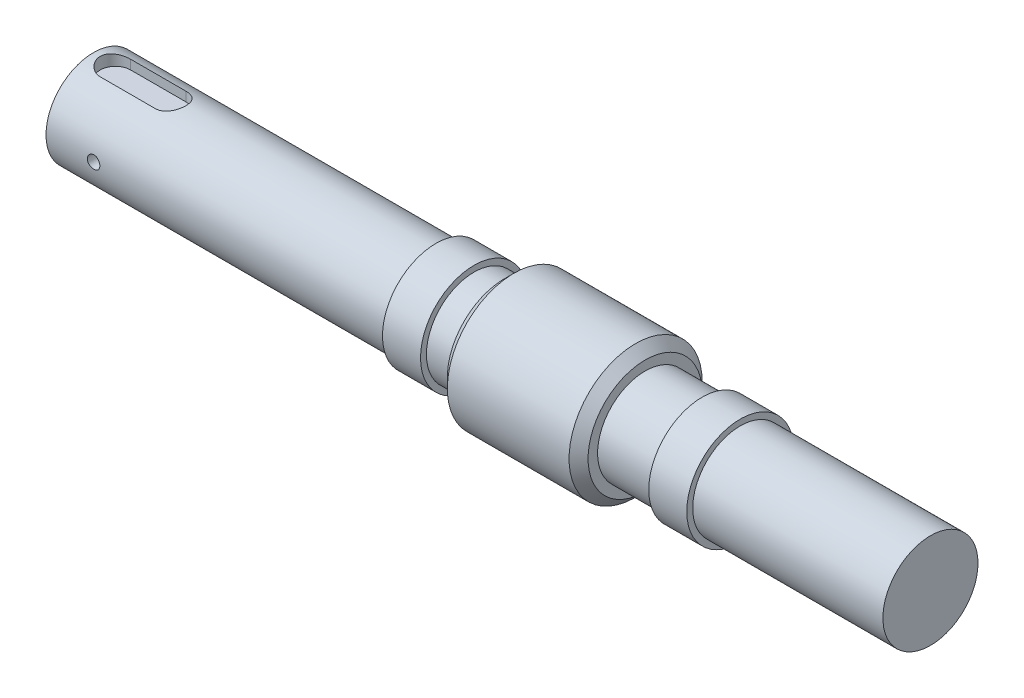
from build123d import *

# Parameters (mm, degrees)
CROQUIS1_R                                 = 35
SALIENTE_EXTRUIR1_DEPTH                    = 37
CHAFL_N1_SIZE                              = 5
CROQUIS2_R                                 = 25
SALIENTE_EXTRUIR2_DEPTH                    = 16
CROQUIS3_R                                 = 28.1
SALIENTE_EXTRUIR3_DEPTH                    = 120
SALIENTE_EXTRUIR4_START                    = 30
CROQUIS4_R                                 = 25
SALIENTE_EXTRUIR4_DEPTH                    = 30
SALIENTE_EXTRUIR5_START                    = 120
CROQUIS5_R                                 = 28.1
SALIENTE_EXTRUIR5_DEPTH                    = 120
CORTAR_EXTRUIR1_START                      = -100
CROQUIS6_R                                 = 28.1
CROQUIS6_R_2                               = 25
CORTAR_EXTRUIR1_DEPTH                      = 100
CROQUIS8_R                                 = 28.1
CROQUIS8_R_2                               = 25
CORTAR_EXTRUIR2_DEPTH                      = 100
CROQUIS9_R                                 = 25
SALIENTE_EXTRUIR6_DEPTH                    = 80
CORTAR_EXTRUIR3_START                      = 18.8
CORTAR_EXTRUIR3_DEPTH                      = 6.2
TALADRO_DE_MARGEN_PARA_M61_D               = 6.6
TALADRO_DE_MARGEN_PARA_M61_DEPTH           = 17
TALADRO_DE_MARGEN_PARA_M61_TIP             = 1.982840043
TALADRO_DE_MARGEN_PARA_M61_ON_FACE_2_D     = 6.6
TALADRO_DE_MARGEN_PARA_M61_ON_FACE_2_DEPTH = 17
TALADRO_DE_MARGEN_PARA_M61_ON_FACE_2_TIP   = 1.982840043


with BuildPart() as part:
    # Croquis1 → Saliente-Extruir1 (new, symmetric)
    with BuildSketch(Plane(origin=(0, 0, 0), x_dir=(0, 0, -1), z_dir=(1, 0, 0))):
        Circle(CROQUIS1_R)
    extrude(amount=SALIENTE_EXTRUIR1_DEPTH, both=True)

    # Chaflán1
    chafl_n1_edges = [part.edges().sort_by_distance(p)[0] for p in [
        (37, 0, 35),
        (-37, 0, 35),
    ]]
    chamfer(chafl_n1_edges, length=CHAFL_N1_SIZE)

    # Croquis2 → Saliente-Extruir2 (add)
    with BuildSketch(Plane.ZY.offset(37)):
        Circle(CROQUIS2_R)
    extrude(amount=SALIENTE_EXTRUIR2_DEPTH)

    # Croquis3 → Saliente-Extruir3 (add)
    with BuildSketch(Plane.ZY.offset(53)):
        Circle(CROQUIS3_R)
    extrude(amount=SALIENTE_EXTRUIR3_DEPTH)

    # Croquis4 → Saliente-Extruir4 (add)
    with BuildSketch(Plane(origin=(37, 0, 0), x_dir=(0, 0, -1), z_dir=(1, 0, 0)).offset(SALIENTE_EXTRUIR4_START)):
        Circle(CROQUIS4_R)
    extrude(amount=-SALIENTE_EXTRUIR4_DEPTH)

    # Croquis5 → Saliente-Extruir5 (add)
    with BuildSketch(Plane(origin=(67, 0, 0), x_dir=(0, 0, -1), z_dir=(1, 0, 0)).offset(SALIENTE_EXTRUIR5_START)):
        Circle(CROQUIS5_R)
    extrude(amount=-SALIENTE_EXTRUIR5_DEPTH)

    # Croquis6 → Cortar-Extruir1 (cut)
    with BuildSketch(Plane.ZY.offset(173).offset(CORTAR_EXTRUIR1_START)):
        Circle(CROQUIS6_R)
        Circle(CROQUIS6_R_2, mode=Mode.SUBTRACT)
    extrude(amount=CORTAR_EXTRUIR1_DEPTH, mode=Mode.SUBTRACT)

    # Croquis8 → Cortar-Extruir2 (cut)
    with BuildSketch(Plane(origin=(187, 0, 0), x_dir=(0, 0, -1), z_dir=(1, 0, 0))):
        Circle(CROQUIS8_R)
        Circle(CROQUIS8_R_2, mode=Mode.SUBTRACT)
    extrude(amount=-CORTAR_EXTRUIR2_DEPTH, mode=Mode.SUBTRACT)

    # Croquis9 → Saliente-Extruir6 (add)
    with BuildSketch(Plane.ZY.offset(173)):
        Circle(CROQUIS9_R)
    extrude(amount=SALIENTE_EXTRUIR6_DEPTH)

    # Croquis10 → Cortar-Extruir3 (cut)
    with BuildSketch(Plane(origin=(0, 0, 0), x_dir=(1, 0, 0), z_dir=(0, 1, 0)).offset(CORTAR_EXTRUIR3_START)):
        with BuildLine():
            Line((-241.5, 8), (-212.5, 8))
            ThreePointArc((-212.5, 8), (-204.5, 0), (-212.5, -8))
            Line((-212.5, -8), (-241.5, -8))
            ThreePointArc((-241.5, -8), (-249.5, 0), (-241.5, 8))
        make_face()
    extrude(amount=CORTAR_EXTRUIR3_DEPTH, mode=Mode.SUBTRACT)

    # Taladro de margen para M61
    with Locations(Plane(origin=(-228, -25, 0), x_dir=(0, 0, -1), z_dir=(0, -1, 0))):
        with Locations((0, 0)):
            Hole(TALADRO_DE_MARGEN_PARA_M61_D / 2, depth=TALADRO_DE_MARGEN_PARA_M61_DEPTH)
            with Locations((0, 0, -(TALADRO_DE_MARGEN_PARA_M61_DEPTH + TALADRO_DE_MARGEN_PARA_M61_TIP / 2))):  # 118° drill point
                Cone(0, TALADRO_DE_MARGEN_PARA_M61_D / 2, TALADRO_DE_MARGEN_PARA_M61_TIP, mode=Mode.SUBTRACT)

    # Taladro de margen para M61 on face 2
    with Locations(Plane(origin=(-228, 0, 25), x_dir=(1, 0, 0), z_dir=(0, 0, 1))):
        with Locations((0, 0)):
            Hole(TALADRO_DE_MARGEN_PARA_M61_ON_FACE_2_D / 2, depth=TALADRO_DE_MARGEN_PARA_M61_ON_FACE_2_DEPTH)
            with Locations((0, 0, -(TALADRO_DE_MARGEN_PARA_M61_ON_FACE_2_DEPTH + TALADRO_DE_MARGEN_PARA_M61_ON_FACE_2_TIP / 2))):  # 118° drill point
                Cone(0, TALADRO_DE_MARGEN_PARA_M61_ON_FACE_2_D / 2, TALADRO_DE_MARGEN_PARA_M61_ON_FACE_2_TIP, mode=Mode.SUBTRACT)


solid = part.part
